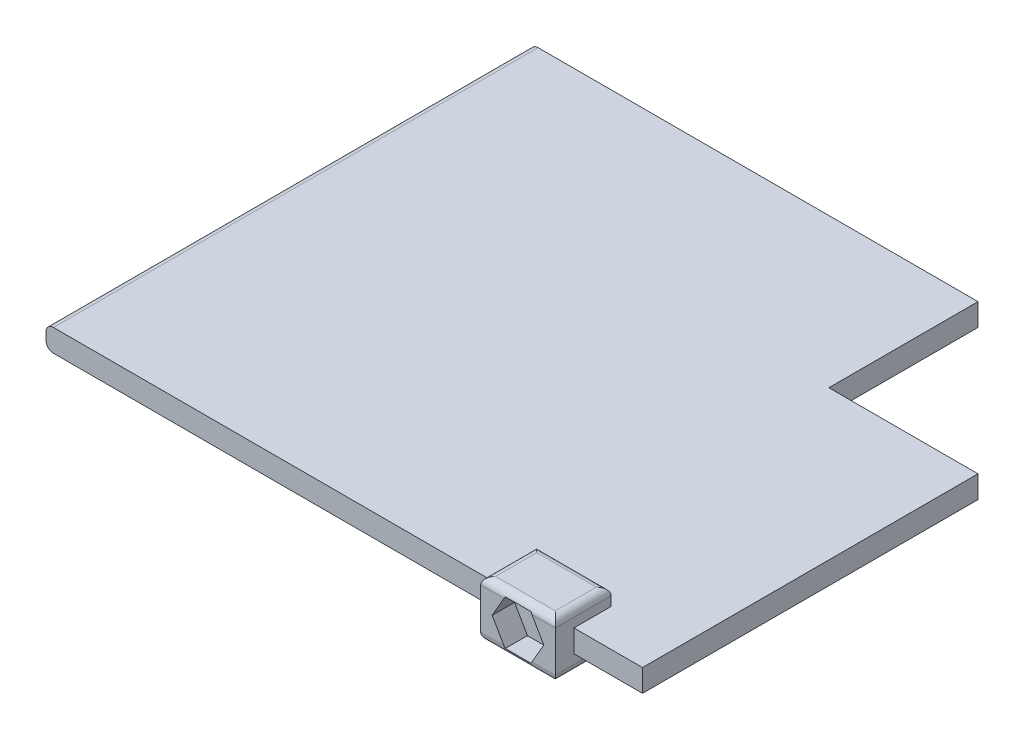
from build123d import *

# Parameters (mm, degrees)
SKETCH2_W                = 160
SKETCH2_H                = 130
BOSS_EXTRUDE1_DEPTH      = 6
SKETCH7_W                = 40
SKETCH7_H                = 40
CUT_EXTRUDE1_DEPTH       = 18
SKETCH9_R                = 2
CUT_EXTRUDE2_DEPTH       = 63
BOSS_EXTRUDE2_DEPTH      = 5
BOSS_EXTRUDE2_DEPTH_BACK = 10
SKETCH11_W               = 20
SKETCH11_H               = 15
CUT_EXTRUDE4_DEPTH       = 6
SKETCH13_R               = 2
CUT_EXTRUDE5_DEPTH       = 222
FILLET4_R                = 2
FILLET5_R                = 2
FILLET6_R                = 2


with BuildPart() as part:
    # Sketch2 → Boss-Extrude1 (new body)
    with BuildSketch(Plane(origin=(0, 0, 0), x_dir=(1, 0, 0), z_dir=(0, 1, 0))):
        Rectangle(SKETCH2_W, SKETCH2_H)
    extrude(amount=BOSS_EXTRUDE1_DEPTH)

    # Sketch7 → Cut-Extrude1 (cut)
    with BuildSketch(Plane(origin=(0, 6, 0), x_dir=(1, 0, 0), z_dir=(0, 1, 0))):
        with Locations((60, 45)):
            Rectangle(SKETCH7_W, SKETCH7_H)
    extrude(amount=-CUT_EXTRUDE1_DEPTH, mode=Mode.SUBTRACT)

    # Sketch9 → Cut-Extrude2 (cut)
    with BuildSketch(Plane.XY.offset(65)):
        with Locations((51.606058682, 2.978215898)):
            Circle(SKETCH9_R)
    extrude(amount=-CUT_EXTRUDE2_DEPTH, mode=Mode.SUBTRACT)

    # Sketch11 → Boss-Extrude2 (add, two sides: drawn at the far end of the back side and taken through both)
    with BuildSketch(Plane.XY.offset(65).offset(-BOSS_EXTRUDE2_DEPTH_BACK)):
        with Locations((51.606058682, 2.978215898)):
            Rectangle(SKETCH11_W, SKETCH11_H)
    extrude(amount=BOSS_EXTRUDE2_DEPTH + BOSS_EXTRUDE2_DEPTH_BACK)

    # Sketch12 → Cut-Extrude4 (cut)
    with BuildSketch(Plane.XY.offset(70)):
        Polygon((55.07279114, -3.020264415), (58.534261247, 2.981254118), (55.067528789, 8.979734431), (48.139326225, 8.976696212), (44.677856118, 2.975177679), (48.144588576, -3.023302634), align=None)
    extrude(amount=-CUT_EXTRUDE4_DEPTH, mode=Mode.SUBTRACT)

    # Sketch13 → Cut-Extrude5 (cut)
    with BuildSketch(Plane.XY.offset(64)):
        with Locations((51.606058682, 2.978215898)):
            Circle(SKETCH13_R)
    extrude(amount=-CUT_EXTRUDE5_DEPTH, mode=Mode.SUBTRACT)

    # Fillet4
    fillet4_edges = [part.edges().sort_by_distance(p)[0] for p in [
        (-80, 6, 0),
        (-80, 0, 0),
    ]]
    fillet(fillet4_edges, radius=FILLET4_R)

    # Fillet5
    # the kernel refuses this fillet: 2 mm, written as the material it takes off along each edge
    with BuildSketch(Plane(origin=(36.606058682, -4.521784102, 70), x_dir=(0, 0, -1), z_dir=(1, 0, 0)), Plane(origin=(36.606058682, -4.521784102, 55), x_dir=(0, 1, 0), z_dir=(1, 0, 0))) as fillet5_piece_1:
        with BuildLine():
            CenterArc((FILLET5_R, FILLET5_R), FILLET5_R, 180, 90)
            Line((0, FILLET5_R), (0, 0))
            Line((0, 0), (FILLET5_R, 0))
        make_face()
    extrude(amount=30, mode=Mode.SUBTRACT)
    with BuildSketch(Plane(origin=(61.606058682, -4.521784102, 50), x_dir=(0, 1, 0), z_dir=(0, 0, 1)), Plane(origin=(41.606058682, -4.521784102, 75), x_dir=(0, 1, 0), z_dir=(0, 0, -1))) as fillet5_piece_2:
        with BuildLine():
            CenterArc((FILLET5_R, FILLET5_R), FILLET5_R, 180, 90)
            Line((0, FILLET5_R), (0, 0))
            Line((0, 0), (FILLET5_R, 0))
        make_face()
    extrude(amount=25, mode=Mode.SUBTRACT)

    # Fillet6
    # the kernel refuses this fillet: 2 mm, written as the material it takes off along each edge
    with BuildSketch(Plane(origin=(66.606058682, 10.478215898, 70), x_dir=(0, 0, -1), z_dir=(-1, 0, 0))) as fillet6_piece_1:
        with BuildLine():
            CenterArc((FILLET6_R, FILLET6_R), FILLET6_R, 180, 90)
            Line((0, FILLET6_R), (0, 0))
            Line((0, 0), (FILLET6_R, 0))
        make_face()
    extrude(amount=30, mode=Mode.SUBTRACT)
    with BuildSketch(Plane(origin=(41.606058682, 10.478215898, 75), x_dir=(0, -1, 0), z_dir=(0, 0, -1)), Plane(origin=(61.606058682, 10.478215898, 50), x_dir=(0, -1, 0), z_dir=(0, 0, 1))) as fillet6_piece_2:
        with BuildLine():
            CenterArc((FILLET6_R, -FILLET6_R), FILLET6_R, 90, 90)
            Line((0, -FILLET6_R), (0, 0))
            Line((0, 0), (FILLET6_R, 0))
        make_face()
    extrude(amount=25, mode=Mode.SUBTRACT)
    with BuildSketch(Plane(origin=(66.606058682, 10.478215898, 55), x_dir=(0, 0, 1), z_dir=(-1, 0, 0))) as fillet6_piece_3:
        with BuildLine():
            CenterArc((FILLET6_R, -FILLET6_R), FILLET6_R, 90, 90)
            Line((0, -FILLET6_R), (0, 0))
            Line((0, 0), (FILLET6_R, 0))
        make_face()
    extrude(amount=30, mode=Mode.SUBTRACT)


solid = part.part
